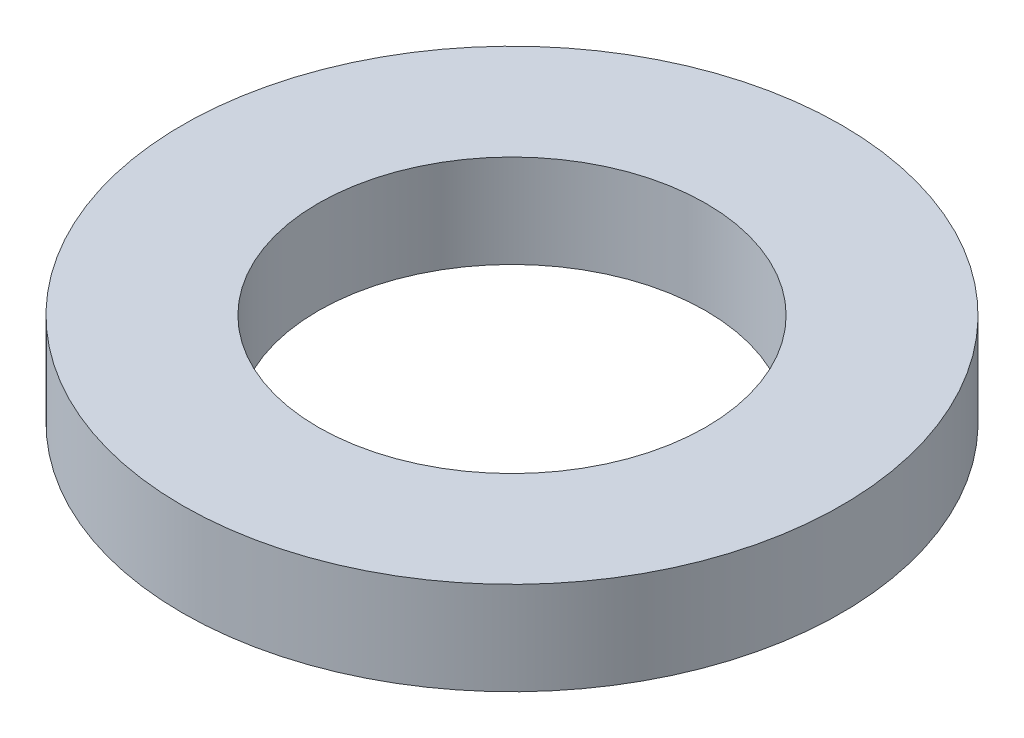
from build123d import *

# Parameters (mm, degrees)
SKETCH1_R           = 85
BOSS_EXTRUDE1_DEPTH = 24
SKETCH2_R           = 50
CUT_EXTRUDE1_DEPTH  = 123.580585739


with BuildPart() as part:
    # Sketch1 → Boss-Extrude1 (new body)
    with BuildSketch(Plane(origin=(0, 0, 0), x_dir=(1, 0, 0), z_dir=(0, 1, 0))):
        Circle(SKETCH1_R)
    extrude(amount=BOSS_EXTRUDE1_DEPTH)

    # Sketch2 → Cut-Extrude1 (cut, through all)
    with BuildSketch(Plane(origin=(0, 0, 0), x_dir=(1, 0, 0), z_dir=(0, 1, 0))):
        Circle(SKETCH2_R)
    extrude(amount=CUT_EXTRUDE1_DEPTH, mode=Mode.SUBTRACT)


solid = part.part
